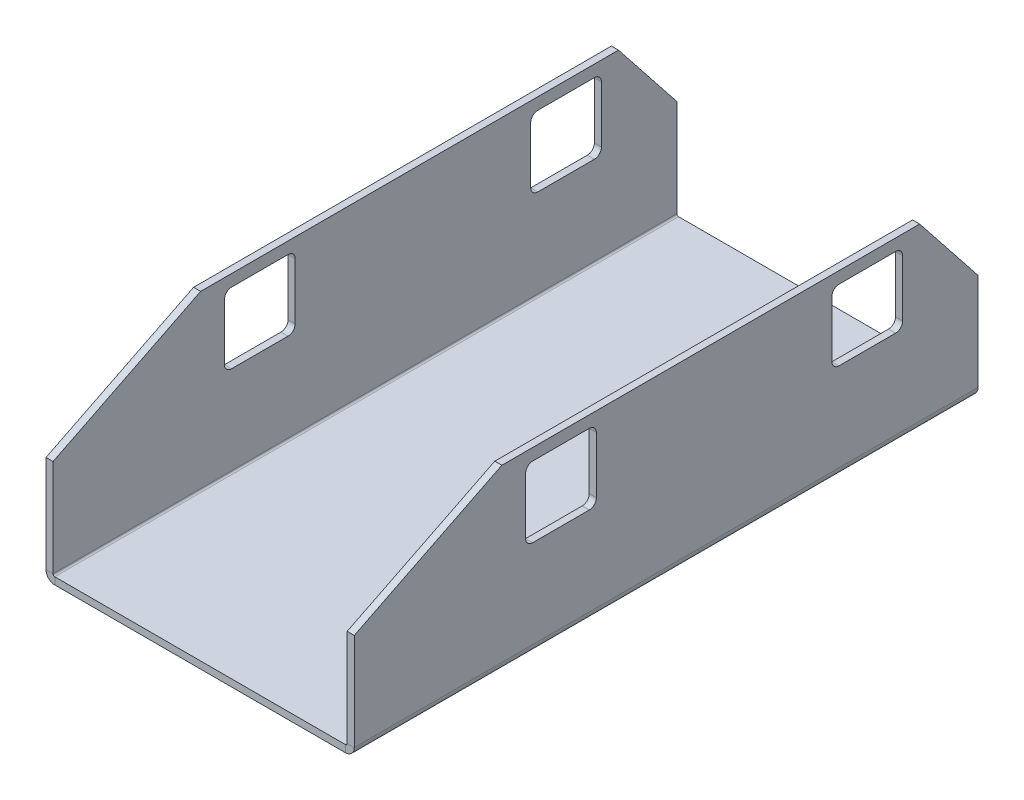
from build123d import *

# Parameters (mm, degrees)
SKETCH_1_W                       = 65.418154724
SKETCH_1_H                       = 264.733197448
SM_BASE_FLANGE_1_DEPTH           = 3
SM_EDGE_FLANGE_1_STRIP_W         = 13.48
SM_EDGE_FLANGE_1_STRIP_H         = 3
SM_EDGE_FLANGE_1_STRIP_CUT_DEPTH = 264.733197448
SM_EDGE_FLANGE_1_DEPTH           = 264.733197448
SM_EDGE_FLANGE_1_FLAT_DEPTH      = 3
OTHER_START                      = -65.418154724
OTHER_1_DEPTH                    = 3


# Read off the part's stored shape, not the designer's step: Полость1
# Sheet-metal steps are written as plain solids
with BuildPart() as part:
    # Sketch 1 → Базовая кромка1 (new body)
    with BuildSketch(Plane(origin=(0, 0, 0), x_dir=(1, 0, 0), z_dir=(0, 1, 0))):
        with Locations((-32.709077362, 29.633401276)):
            Rectangle(SKETCH_1_W, SKETCH_1_H)
    extrude(amount=SM_BASE_FLANGE_1_DEPTH)

    # Ребро-кромка1 strip (across the edge) → Ребро-кромка1 strip cut (cut)
    with BuildSketch(Plane(origin=(-65.418154724, 3, -162), x_dir=(1, 0, 0), z_dir=(0, 0, 1))):
        with Locations((-3, -1.5)):
            Rectangle(SM_EDGE_FLANGE_1_STRIP_W, SM_EDGE_FLANGE_1_STRIP_H)
    extrude(amount=SM_EDGE_FLANGE_1_STRIP_CUT_DEPTH, mode=Mode.SUBTRACT)

    # Ребро-кромка1 bend section (across the edge) → Ребро-кромка1 (add)
    with BuildSketch(Plane(origin=(-65.418154724, 3, -162), x_dir=(1, 0, 0), z_dir=(0, 0, 1))):
        with BuildLine():
            Line((0, 0.74), (3, 0.74))
            ThreePointArc((3, 0.74), (3.216740982, 0.216740982), (3.74, 0))
            Line((3.74, 0), (3.74, -3))
            ThreePointArc((3.74, -3), (1.095420638, -1.904579362), (0, 0.74))
        make_face()
    extrude(amount=SM_EDGE_FLANGE_1_DEPTH)

    # Ребро-кромка1 profile (on flange) → Ребро-кромка1 flat (add)
    with BuildSketch(Plane(origin=(-65.418154724, 3, 0), x_dir=(0, 0, 1), z_dir=(-1, 0, 0))):
        Polygon((-162, 0.74), (102.733197448, 0.74), (102.733197448, 42), (40.090960975, 73.22618932), (-137.247403995, 73.22618932), (-162, 42), align=None)
    extrude(amount=-SM_EDGE_FLANGE_1_FLAT_DEPTH)

    # Полость1 outline → Полость1 (cut)
    with BuildSketch(Plane.YZ.offset(OTHER_START)):
        with BuildLine():
            ThreePointArc((44.22618932, 30), (42.104868976, 29.121320344), (41.22618932, 27))
            Line((41.22618932, 27), (41.22618932, 3))
            ThreePointArc((41.22618932, 3), (42.104868976, 0.878679656), (44.22618932, 0))
            Line((44.22618932, 0), (68.22618932, 0))
            ThreePointArc((68.22618932, 0), (70.347509663, 0.878679657), (71.22618932, 3))
            Line((71.22618932, 3), (71.22618932, 27))
            ThreePointArc((71.22618932, 27), (70.347509663, 29.121320343), (68.22618932, 30))
            Line((68.22618932, 30), (44.22618932, 30))
        make_face()
        with BuildLine():
            ThreePointArc((44.22618932, -100), (42.104868976, -100.878679656), (41.22618932, -103))
            Line((41.22618932, -103), (41.22618932, -127))
            ThreePointArc((41.22618932, -127), (42.104868976, -129.121320344), (44.22618932, -130))
            Line((44.22618932, -130), (68.22618932, -130))
            ThreePointArc((68.22618932, -130), (70.347509663, -129.121320344), (71.22618932, -127))
            Line((71.22618932, -127), (71.22618932, -103))
            ThreePointArc((71.22618932, -103), (70.347509663, -100.878679656), (68.22618932, -100))
            Line((68.22618932, -100), (44.22618932, -100))
        make_face()
    extrude(amount=OTHER_1_DEPTH, mode=Mode.SUBTRACT)

    # Зеркальное отражение1: part across plane


with BuildPart() as part_1:
    add(part.part)
    add(part.part.mirror(Plane(origin=(0, 3, -162), x_dir=(0, 0, 1), z_dir=(-1, 0, 0))))


solid = part_1.part
